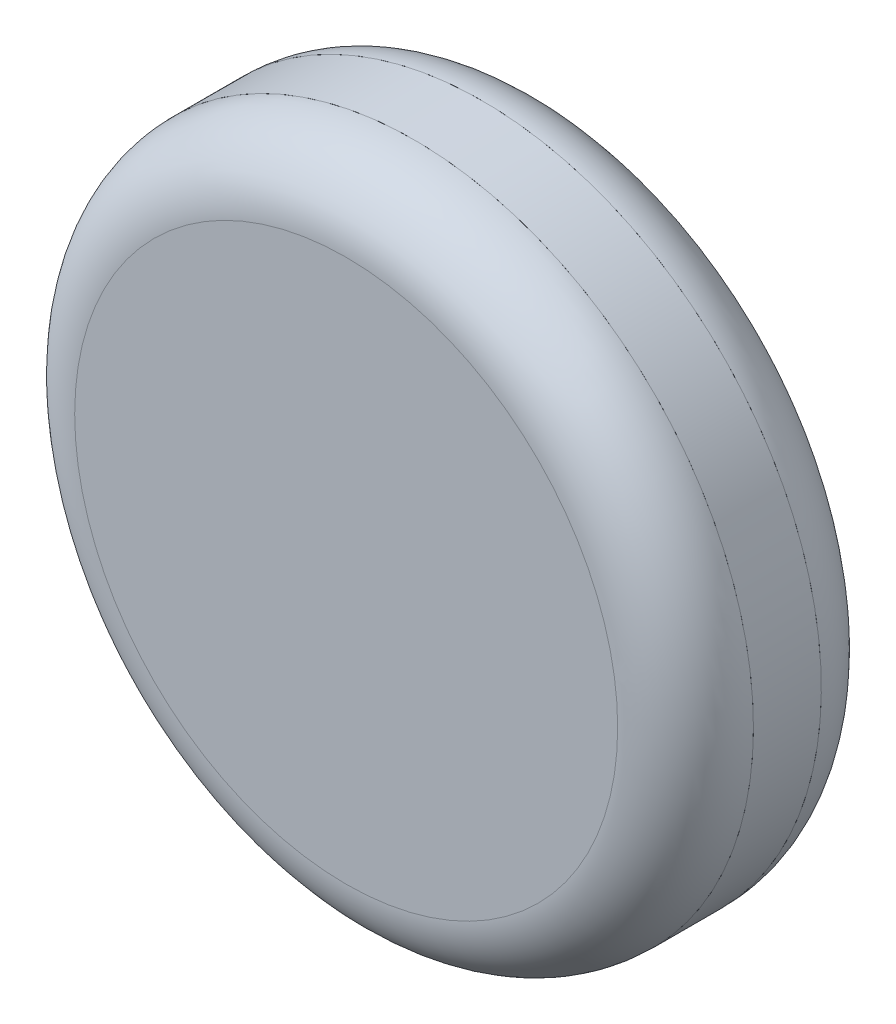
from build123d import *

# Parameters (mm, degrees)
BOSS_EXTRUDE1_DEPTH = 2
SKETCH2_R           = 10
BOSS_EXTRUDE2_DEPTH = 2
SKETCH3_R           = 10
BOSS_EXTRUDE3_DEPTH = 2
FILLET2_R           = 2
FILLET3_R           = 2


with BuildPart() as part:
    # Sketch1 → Boss-Extrude1 (new body)
    with BuildSketch(Plane.XY):
        with BuildLine():
            ThreePointArc((10, 0), (-6.519202405, 7.582875444), (-1.5, -9.886859967))
            Line((-1.5, -9.886859967), (-1.5, 0))
            ThreePointArc((-1.5, 0), (0, 1.5), (1.5, 0))
            Line((1.5, 0), (1.5, -9.886859967))
            ThreePointArc((1.5, -9.886859967), (7.582875444, -6.519202405), (10, 0))
        make_face()
    extrude(amount=BOSS_EXTRUDE1_DEPTH)


with BuildPart() as body_2:
    # Sketch2 → Boss-Extrude2 (new body)
    with BuildSketch(Plane.XY.offset(2)):
        Circle(SKETCH2_R)
    extrude(amount=BOSS_EXTRUDE2_DEPTH)

    # Fillet3
    fillet3_edges = [body_2.edges().sort_by_distance(p)[0] for p in [
        (-10, 0, 4),
    ]]
    fillet(fillet3_edges, radius=FILLET3_R - 0.0001)  # a hair under: the kernel refuses the full size


with BuildPart() as body_3:
    # Sketch3 → Boss-Extrude3 (new body)
    with BuildSketch(Plane(origin=(0, 0, 0), x_dir=(-1, 0, 0), z_dir=(0, 0, -1))):
        Circle(SKETCH3_R)
    extrude(amount=BOSS_EXTRUDE3_DEPTH)

    # Fillet2
    fillet2_edges = [body_3.edges().sort_by_distance(p)[0] for p in [
        (10, 0, -2),
    ]]
    fillet(fillet2_edges, radius=FILLET2_R - 0.0001)  # a hair under: the kernel refuses the full size


solid = Compound([part.part, body_2.part, body_3.part])
